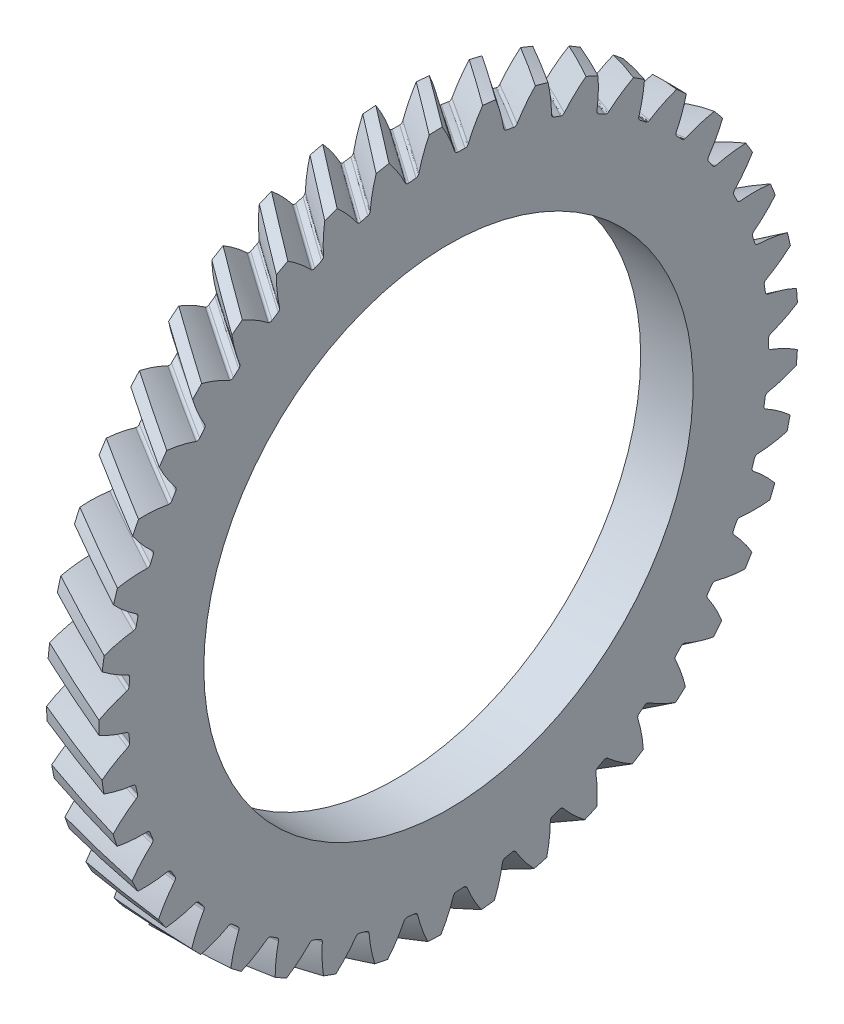
from build123d import *

# Parameters (mm, degrees)
BASPROSKE_W            = 6
BASPROSKE_H            = 40.003171488
TOOTHCUTRH_PITCH       = 333.549185094
TOOTHCUTRH_HEIGHT      = 6
TOOTHCUTRH_RADIUS      = 40.003171488
TOOTHCUTRH_START_ANGLE = -90
TEETHCUTSRH_COUNT      = 41
TEETHCUTSRH_ANGLE      = 351.219512195
BORSKE_R               = 28
BORE_DEPTH             = 62.5000025


with BuildPart() as part:
    # BasProSke → Base-Revolve (revolve)
    with BuildSketch(Plane(origin=(0, 0, 0), x_dir=(1, 0, 0), z_dir=(0, 1, 0)), mode=Mode.PRIVATE) as base_revolve_sk:
        with Locations((3, 20.001585744)):
            Rectangle(BASPROSKE_W, BASPROSKE_H)
    revolve(base_revolve_sk.sketch.rotate(Axis((-10, 0, 0), (1, 0, 0)), 180), axis=Axis((-10, 0, 0), (1, 0, 0)))

    # ToothCutRH: sweep along a helix
    with BuildLine() as toothcutrh_path:
        add(Helix(TOOTHCUTRH_PITCH, TOOTHCUTRH_HEIGHT, TOOTHCUTRH_RADIUS, center=(0, 0, 0), direction=(1, 0, 0), mode=Mode.PRIVATE).rotate(Axis((0, 0, 0), (1, 0, 0)), TOOTHCUTRH_START_ANGLE))
    # TooCutSkeRH → ToothCutRH (sweep, cut)
    with BuildSketch(Plane(origin=(0, 0, 0), x_dir=(0, 0, -1), z_dir=(1, 0, 0))):
        with BuildLine():
            ThreePointArc((0.421648334, 36.625744487), (0, 36.628171488), (-0.421648334, 36.625744487))
            ThreePointArc((-0.421648334, 36.625744487), (-0.639329075, 36.692112145), (-0.778853492, 36.87189676))
            ThreePointArc((-0.778853492, 36.87189676), (-1.790911911, 39.070892726), (-3.135572187, 41.083784737))
            ThreePointArc((-3.135572187, 41.083784737), (0, 41.203266633), (3.135572187, 41.083784737))
            ThreePointArc((3.135572187, 41.083784737), (1.790911911, 39.070892726), (0.778853492, 36.87189676))
            ThreePointArc((0.778853492, 36.87189676), (0.639329075, 36.692112145), (0.421648334, 36.625744487))
        make_face()
    toothcutrh = sweep(path=toothcutrh_path.line, is_frenet=True, mode=Mode.SUBTRACT)

    # TeethCutsRH: ToothCutRH ×41 about axis
    teethcutsrh_axis = Axis((-10, 0, 0), (1, 0, 0))
    for i in range(1, TEETHCUTSRH_COUNT):
        add(toothcutrh.rotate(teethcutsrh_axis, i * TEETHCUTSRH_ANGLE / (TEETHCUTSRH_COUNT - 1)), mode=Mode.SUBTRACT)

    # BorSke → Bore (cut, symmetric)
    with BuildSketch(Plane(origin=(0, 0, 0), x_dir=(0, 0, -1), z_dir=(1, 0, 0))):
        with Locations(Location((0, 0, 0), (0, 0, 180))):
            Circle(BORSKE_R)
    extrude(amount=BORE_DEPTH, both=True, mode=Mode.SUBTRACT)


solid = part.part
